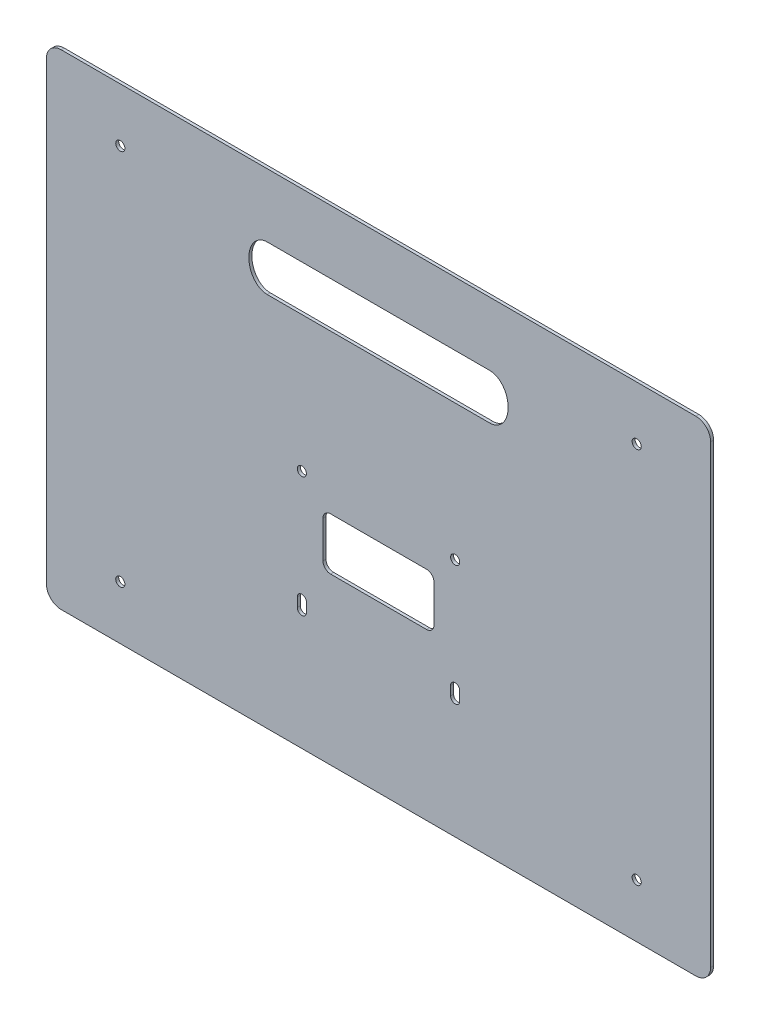
from build123d import *

# Parameters (mm, degrees)
SKETCH2_W               = 450.48
SKETCH2_H               = 328.82
BOSS_EXTRUDE1_DEPTH     = 2.032
CUT_EXTRUDE1_DEPTH      = 279.868848608
CUT_EXTRUDE1_DEPTH_BACK = 279.868848608
SKETCH3_R               = 3.1
FILLET1_R               = 10
CUT_EXTRUDE6_DEPTH      = 279.868848608
SKETCH9_R               = 3.1
CUT_EXTRUDE7_DEPTH      = 279.868848608
CUT_EXTRUDE8_DEPTH      = 279.868848608


with BuildPart() as part:
    # Sketch2 → Boss-Extrude1 (new body)
    with BuildSketch(Plane.XY):
        Rectangle(SKETCH2_W, SKETCH2_H)
    extrude(amount=BOSS_EXTRUDE1_DEPTH)

    # Sketch3 → Cut-Extrude1 (cut, two sides: drawn at the far end of the back side and taken through both)
    with BuildSketch(Plane.XY.offset(2.032).offset(-CUT_EXTRUDE1_DEPTH_BACK)):
        with Locations((-175.117048267, 128.010047732)):
            Circle(SKETCH3_R)
        with Locations((175.116951733, 128.010047732)):
            Circle(SKETCH3_R)
        with Locations((-175.117051477, -128.009951732)):
            Circle(SKETCH3_R)
        with Locations((175.116948523, -128.009951732)):
            Circle(SKETCH3_R)
    extrude(amount=CUT_EXTRUDE1_DEPTH + CUT_EXTRUDE1_DEPTH_BACK, mode=Mode.SUBTRACT)

    # Fillet1
    fillet1_edges = [part.edges().sort_by_distance(p)[0] for p in [
        (-225.24, -164.41, 1.016),
        (225.24, -164.41, 1.016),
        (225.24, 164.41, 1.016),
        (-225.24, 164.41, 1.016),
    ]]
    fillet(fillet1_edges, radius=FILLET1_R)

    # Sketch8 → Cut-Extrude6 (cut, through all)
    with BuildSketch(Plane.XY.offset(2.032)):
        with BuildLine():
            Line((-37.67605638, -47.009952268), (-37.67605638, -22.009952268))
            ThreePointArc((-37.67605638, -22.009952268), (-36.160038703, -18.349961833), (-32.500048267, -16.833944156))
            Line((-32.500048267, -16.833944156), (32.499951733, -16.833944156))
            ThreePointArc((32.499951733, -16.833944156), (36.159942169, -18.349961833), (37.675959845, -22.009952268))
            Line((37.675959845, -22.009952268), (37.675959845, -47.009952268))
            ThreePointArc((37.675959845, -47.009952268), (36.159942169, -50.669942704), (32.499951733, -52.185960381))
            Line((32.499951733, -52.185960381), (-32.500048267, -52.185960381))
            ThreePointArc((-32.500048267, -52.185960381), (-36.160038703, -50.669942704), (-37.67605638, -47.009952268))
        make_face()
    extrude(amount=-CUT_EXTRUDE6_DEPTH, mode=Mode.SUBTRACT)

    # Sketch9 → Cut-Extrude7 (cut, through all)
    with BuildSketch(Plane.XY.offset(2.032)):
        with Locations((-51.997892774, -1.512107761)):
            Circle(SKETCH9_R)
        with Locations((51.99779624, -1.512107761)):
            Circle(SKETCH9_R)
        with BuildLine():
            Line((-48.897892774, -76.907796776), (-48.897892774, -83.107796776))
            ThreePointArc((-48.897892774, -83.107796776), (-51.997892774, -86.207796776), (-55.097892774, -83.107796776))
            Line((-55.097892774, -83.107796776), (-55.097892774, -76.907796776))
            ThreePointArc((-55.097892774, -76.907796776), (-51.997892774, -73.807796776), (-48.897892774, -76.907796776))
        make_face()
        with BuildLine():
            Line((55.09779624, -76.907796776), (55.09779624, -83.107796776))
            ThreePointArc((55.09779624, -83.107796776), (51.99779624, -86.207796776), (48.89779624, -83.107796776))
            Line((48.89779624, -83.107796776), (48.89779624, -76.907796776))
            ThreePointArc((48.89779624, -76.907796776), (51.99779624, -73.807796776), (55.09779624, -76.907796776))
        make_face()
    extrude(amount=-CUT_EXTRUDE7_DEPTH, mode=Mode.SUBTRACT)

    # Sketch10 → Cut-Extrude8 (cut, through all)
    with BuildSketch(Plane.XY.offset(2.032)):
        with BuildLine():
            Line((75.499951727, 90.514280158), (-75.500048275, 90.514280158))
            add(Edge.make_bspline(
                [(-75.500048275, 90.514280158), (-75.636412549, 90.514280158), (-75.917796947, 90.520302254), (-76.410646527, 90.550508672), (-76.968180619, 90.614638287), (-77.58303823, 90.723962867), (-78.436672516, 90.928993271), (-79.553860376, 91.317103184), (-81.192232551, 92.13830444), (-83.04597149, 93.52972168), (-85.455930234, 96.303941038), (-87.421728411, 100.500304347), (-88.178110964, 105.952830742), (-87.41754915, 111.376654294), (-85.470192869, 115.556046858), (-83.350179234, 117.998572825), (-81.951703976, 119.172376245), (-80.787217211, 119.943996814), (-79.560035504, 120.557517299), (-78.481333929, 120.936921473), (-77.58488686, 121.156396514), (-77.000938141, 121.257367088), (-76.558423332, 121.310933808), (-76.240056137, 121.339216481), (-75.907909708, 121.358860531), (-75.631440646, 121.364761188), (-75.500048276, 121.364761188)],
                knots=[0, 0, 0, 0, 0.000333405, 0.000666809, 0.001333619, 0.002000428, 0.002667238, 0.004000857, 0.005334476, 0.008001714, 0.010668952, 0.016003427, 0.021337903, 0.026672379, 0.032006855, 0.034674093, 0.036007712, 0.037341331, 0.038674949, 0.040008568, 0.040675378, 0.041342187, 0.041675592, 0.042008997, 0.042342402, 0.042675806, 0.042675806, 0.042675806, 0.042675806], degree=3))
            Line((-75.500048276, 121.364761188), (75.499999746, 121.36476065))
            add(Edge.make_bspline(
                [(75.499999746, 121.36476065), (75.750466849, 121.364684459), (76.269886979, 121.344144451), (76.934979701, 121.269275676), (77.577073319, 121.156897345), (78.445854267, 120.947486084), (79.559296084, 120.559316654), (81.195851129, 119.738533029), (83.054204012, 118.341905946), (85.462680041, 115.564940217), (87.034138256, 112.198033563), (87.798375379, 108.655783537), (87.989083412, 105.909625261), (87.796389919, 103.211612074), (87.018165146, 99.634910594), (85.481202996, 96.34352734), (83.356315738, 93.886125357), (81.958446845, 92.711961659), (80.793846967, 91.938755527), (79.562562382, 91.322483767), (78.482998265, 90.942673196), (77.587070509, 90.723126653), (77.002893008, 90.621967042), (76.559571909, 90.568232346), (76.240777835, 90.539880918), (75.908213182, 90.520191779), (75.631478625, 90.514280158), (75.499951727, 90.514280158)],
                knots=[-4.2e-08, -4.2e-08, -4.2e-08, -4.2e-08, 0.000668194, 0.001336431, 0.002004668, 0.002672905, 0.004009379, 0.005345853, 0.0080188, 0.010691748, 0.016037643, 0.01871059, 0.021383538, 0.024056485, 0.026729433, 0.032075328, 0.034748275, 0.036084749, 0.037421223, 0.038757696, 0.04009417, 0.040762407, 0.041430644, 0.041764762, 0.042098881, 0.042432999, 0.042767118, 0.042767118, 0.042767118, 0.042767118], degree=3))
        make_face()
    extrude(amount=-CUT_EXTRUDE8_DEPTH, mode=Mode.SUBTRACT)


solid = part.part
